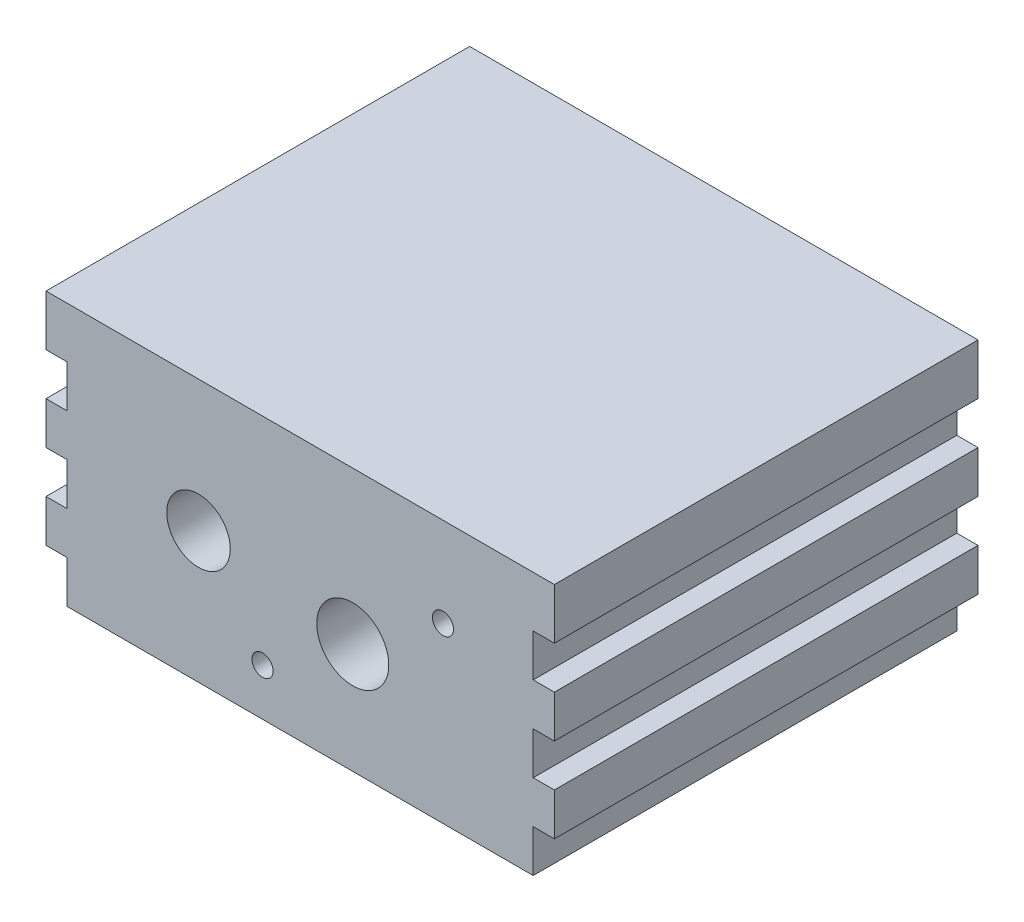
from build123d import *

# Parameters (mm, degrees)
SKETCH_2_W               = 120
SKETCH_2_H               = 62
SKETCH_2_R               = 2.5
SKETCH_2_R_2             = 8.5
SKETCH_2_R_3             = 7.5
EXTRUDE_1_DEPTH          = 100
CUT_EXTRUDE_1_REACH      = 122.669
SKETCH_3_W               = 5
SKETCH_3_H               = 10
PATTERN_LINEAR_1_COUNT   = 3
PATTERN_LINEAR_1_PITCH   = 20
MIRROR_1_COPY_1_REACH    = 122.669
MIRROR_1_COPY_1_SKETCH_W = 5
MIRROR_1_COPY_1_SKETCH_H = 10
MIRROR_1_COPY_2_REACH    = 122.669
MIRROR_1_COPY_2_SKETCH_W = 5
MIRROR_1_COPY_2_SKETCH_H = 10
MIRROR_1_COPY_3_REACH    = 122.669
MIRROR_1_COPY_3_SKETCH_W = 5
MIRROR_1_COPY_3_SKETCH_H = 10


with BuildPart() as part:
    # 스케치2 → 보스-돌출1 (new body)
    with BuildSketch(Plane.XY):
        Rectangle(SKETCH_2_W, SKETCH_2_H)
        with Locations((-8.889677969, -19.912987345)):
            Circle(SKETCH_2_R, mode=Mode.SUBTRACT)
        with Locations((12.408275183, -5)):
            Circle(SKETCH_2_R_2, mode=Mode.SUBTRACT)
        with Locations((-24, 0)):
            Circle(SKETCH_2_R_3, mode=Mode.SUBTRACT)
        with Locations((33.706228335, 9.912987345)):
            Circle(SKETCH_2_R, mode=Mode.SUBTRACT)
    extrude(amount=EXTRUDE_1_DEPTH)

    # 스케치3 → 컷-돌출1 (cut, up to next)
    with BuildSketch(Plane.XY.offset(100), mode=Mode.PRIVATE) as cut_extrude_1_sk1:
        with Locations((-57.5, -26)):
            Rectangle(SKETCH_3_W, SKETCH_3_H)
    cut_extrude_1_tool1 = extrude(cut_extrude_1_sk1.sketch, amount=-CUT_EXTRUDE_1_REACH, mode=Mode.PRIVATE) & part.part
    cut_extrude_1 = cut_extrude_1_tool1.solids().sort_by_distance((-57.5, -26, 100))[0]
    add(cut_extrude_1, mode=Mode.SUBTRACT)

    # 선형 패턴1: 컷-돌출1 ×3
    with Locations(*[(0, i * PATTERN_LINEAR_1_PITCH, 0) for i in range(1, PATTERN_LINEAR_1_COUNT)]):
        add(cut_extrude_1, mode=Mode.SUBTRACT)

    # 대칭 복사1 copy 1 sketch → 대칭 복사1 copy 1 (cut, up to next)
    with BuildSketch(Plane(origin=(0, 20, 100), x_dir=(-1, 0, 0), z_dir=(0, 0, 1)), mode=Mode.PRIVATE) as mirror_1_copy_1_sk1:
        with Locations((-57.5, 26)):
            Rectangle(MIRROR_1_COPY_1_SKETCH_W, MIRROR_1_COPY_1_SKETCH_H)
    mirror_1_copy_1_tool1 = extrude(mirror_1_copy_1_sk1.sketch, amount=-MIRROR_1_COPY_1_REACH, mode=Mode.PRIVATE) & part.part
    add(mirror_1_copy_1_tool1.solids().sort_by_distance((57.5, -6, 100))[0], mode=Mode.SUBTRACT)

    # 대칭 복사1 copy 2 sketch → 대칭 복사1 copy 2 (cut, up to next)
    with BuildSketch(Plane(origin=(0, 40, 100), x_dir=(-1, 0, 0), z_dir=(0, 0, 1)), mode=Mode.PRIVATE) as mirror_1_copy_2_sk1:
        with Locations((-57.5, 26)):
            Rectangle(MIRROR_1_COPY_2_SKETCH_W, MIRROR_1_COPY_2_SKETCH_H)
    mirror_1_copy_2_tool1 = extrude(mirror_1_copy_2_sk1.sketch, amount=-MIRROR_1_COPY_2_REACH, mode=Mode.PRIVATE) & part.part
    add(mirror_1_copy_2_tool1.solids().sort_by_distance((57.5, 14, 100))[0], mode=Mode.SUBTRACT)

    # 대칭 복사1 copy 3 sketch → 대칭 복사1 copy 3 (cut, up to next)
    with BuildSketch(Plane(origin=(0, 0, 100), x_dir=(-1, 0, 0), z_dir=(0, 0, 1)), mode=Mode.PRIVATE) as mirror_1_copy_3_sk1:
        with Locations((-57.5, 26)):
            Rectangle(MIRROR_1_COPY_3_SKETCH_W, MIRROR_1_COPY_3_SKETCH_H)
    mirror_1_copy_3_tool1 = extrude(mirror_1_copy_3_sk1.sketch, amount=-MIRROR_1_COPY_3_REACH, mode=Mode.PRIVATE) & part.part
    add(mirror_1_copy_3_tool1.solids().sort_by_distance((57.5, -26, 100))[0], mode=Mode.SUBTRACT)


solid = part.part
